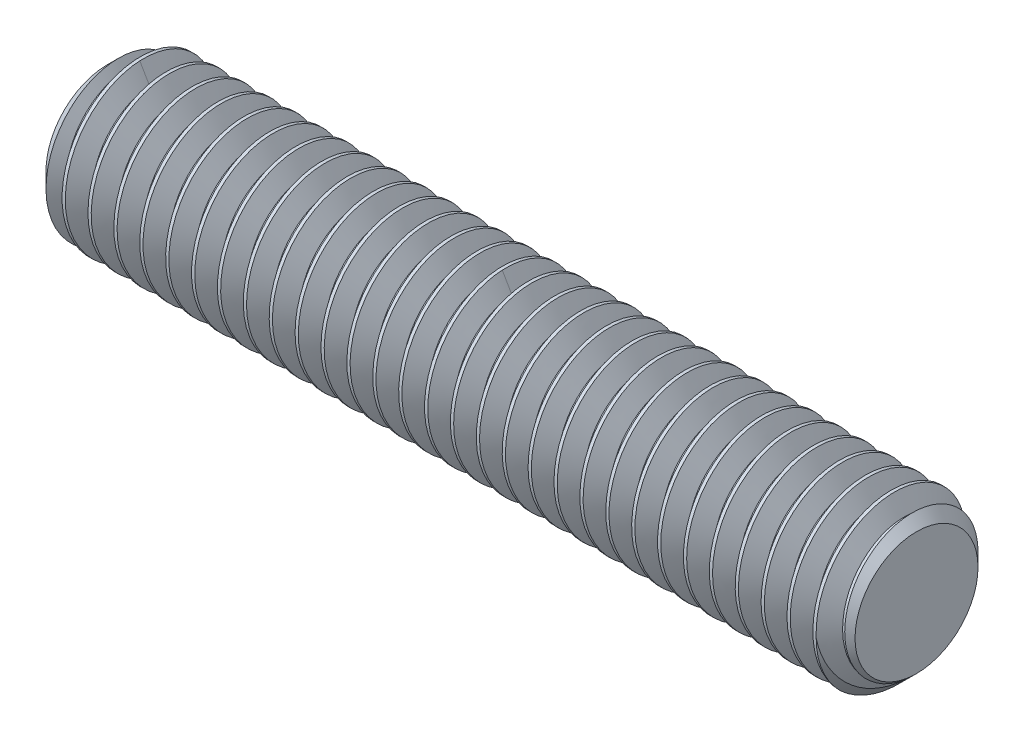
from build123d import *

# Parameters (mm, degrees)
BOSS_EXTRUDE1_DEPTH      = 12.5
BOSS_EXTRUDE1_DEPTH_BACK = 12.5
SKETCH2_R                = 2.5
CHAMFER1_SIZE            = 0.6
CUT_SWEEP3_PITCH         = 0.8
LPATTERN1_COUNT          = 3
LPATTERN1_PITCH          = 11.2


with BuildPart() as part:
    # Sketch2 → Boss-Extrude1 (new, two sides: drawn at the far end of the back side and taken through both)
    with BuildSketch(Plane(origin=(0, 0, 0), x_dir=(0, 0, -1), z_dir=(1, 0, 0)).offset(-BOSS_EXTRUDE1_DEPTH_BACK)):
        Circle(SKETCH2_R)
    extrude(amount=BOSS_EXTRUDE1_DEPTH + BOSS_EXTRUDE1_DEPTH_BACK)

    # Chamfer1
    chamfer1_edges = [part.edges().sort_by_distance(p)[0] for p in [
        (-12.5, 0, 2.5),
        (12.5, 0, 2.5),
    ]]
    chamfer(chamfer1_edges, length=CHAMFER1_SIZE)

    # Cut-Sweep3: arcs per turn and ends read off the stored shape
    # Cut-Sweep3: the profile of Sketch4 screwed along a right-hand helix through 16 turns, 8 arcs to a turn; built about Z, then put on its axis
    cut_sweep3_z = Axis((0, 0, 0), (0, 0, 1))
    cut_sweep3_corners = [(1.980384758, 0, -0.3), (2.54330127, 0, 0.025), (2.54330127, 0, -0.725), (1.980384758, 0, -0.4)]
    with BuildLine(mode=Mode.PRIVATE) as cut_sweep3_profile:
        Line(cut_sweep3_corners[0], cut_sweep3_corners[1])
        Line(cut_sweep3_corners[1], cut_sweep3_corners[2])
        Line(cut_sweep3_corners[2], cut_sweep3_corners[3])
        Line(cut_sweep3_corners[3], cut_sweep3_corners[0])
    cut_sweep3_cap = Face(cut_sweep3_profile.wire())
    cut_sweep3_turn_angles = [0, 22.5, 45, 67.5, 90, 112.5, 135, 157.5, 180, 202.5, 225, 247.5, 270, 292.5, 315, 337.5, 360]
    cut_sweep3_turn_weights = [1, 0.9238795325112867, 1, 0.9238795325112867, 1, 0.9238795325112867, 1, 0.9238795325112867, 1, 0.9238795325112867, 1, 0.9238795325112867, 1, 0.9238795325112867, 1, 0.9238795325112867, 1]
    cut_sweep3_turn_rails = [Edge.make_bspline([Vector(p[0], p[1], 0).rotate(cut_sweep3_z, cut_sweep3_turn_angles[k]) / cut_sweep3_turn_weights[k] + Vector(0, 0, p[2] + CUT_SWEEP3_PITCH * cut_sweep3_turn_angles[k] / 360) for k in range(17)], [0, 0, 0, 1, 1, 2, 2, 3, 3, 4, 4, 5, 5, 6, 6, 7, 7, 8, 8, 8], 2, cut_sweep3_turn_weights) for p in cut_sweep3_corners]
    cut_sweep3_turn_sides = [Face.make_surface_from_curves(cut_sweep3_turn_rails[p[0]], cut_sweep3_turn_rails[p[1]]) for p in [(0, 1), (1, 2), (2, 3), (3, 0)]]
    cut_sweep3 = Plane(origin=(12.5, 0, 0), x_dir=(0, 1, 0), z_dir=(-1, 0, 0)) * Solid(Shell([*[p.moved(Location((0, 0, CUT_SWEEP3_PITCH * i))) for i in range(16) for p in cut_sweep3_turn_sides], cut_sweep3_cap, cut_sweep3_cap.rotate(cut_sweep3_z, 5760).moved(Location((0, 0, CUT_SWEEP3_PITCH * 5760 / 360)))]))
    add(cut_sweep3, mode=Mode.SUBTRACT)

    # LPattern1: Cut-Sweep3 ×3
    with Locations(*[(-i * LPATTERN1_PITCH, 0, 0) for i in range(1, LPATTERN1_COUNT)]):
        add(cut_sweep3, mode=Mode.SUBTRACT)


solid = part.part
